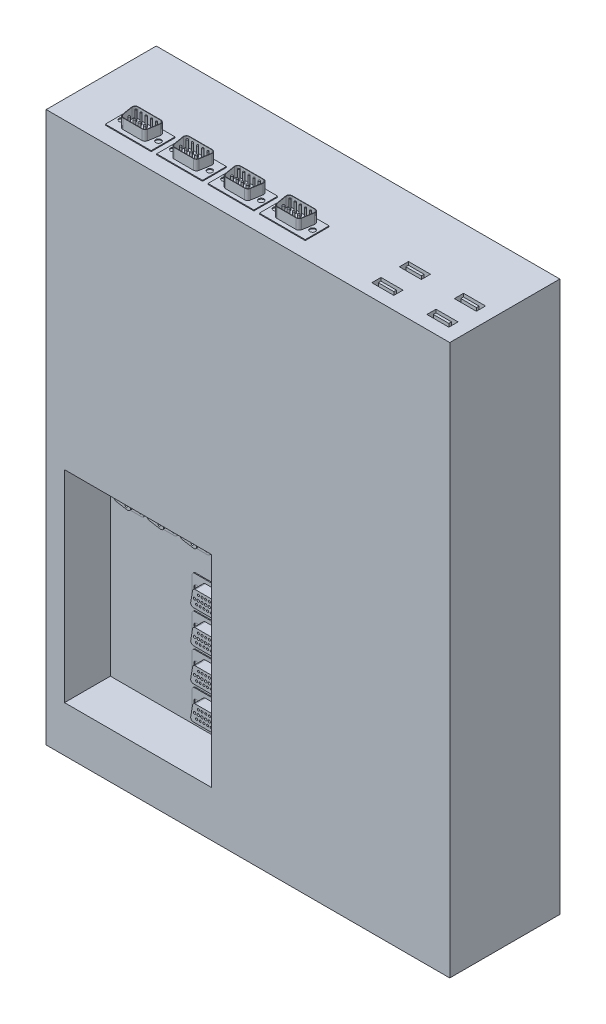
from build123d import *

# Parameters (mm, degrees)
SKETCH_1_W                     = 220
SKETCH_1_H                     = 300
EXTRUDE_1_DEPTH                = 60
SKETCH_2_W                     = 80
SKETCH_2_H                     = 110
CUT_EXTRUDE_1_DEPTH            = 25
SKETCH_3_R                     = 0.566514022
SKETCH_3_R_2                   = 0.666935082
SKETCH_3_R_3                   = 0.554127784
EXTRUDE_2_DEPTH                = 6
SKETCH_4_W                     = 32
SKETCH_4_H                     = 13
SKETCH_4_R                     = 1.5
EXTRUDE_3_DEPTH                = 0.5
FILLET_2_R                     = 1.5
PATTERN_LINEAR_1_COUNT         = 4
PATTERN_LINEAR_1_PITCH         = 18
FILLET_2_OF_PATTERN_LINEAR_1_R = 1.5
SKETCH_5_R                     = 0.592134008
SKETCH_5_R_2                   = 0.635459683
EXTRUDE_4_DEPTH                = 6
SKETCH_6_W                     = 13
SKETCH_6_H                     = 25
SKETCH_6_R                     = 1.5
EXTRUDE_5_DEPTH                = 0.5
FILLET_3_R                     = 1.5
PATTERN_LINEAR_2_COUNT         = 4
PATTERN_LINEAR_2_PITCH         = 18
FILLET_3_OF_PATTERN_LINEAR_2_R = 1.5
SKETCH_7_W                     = 25
SKETCH_7_H                     = 13
SKETCH_7_R                     = 1.5
EXTRUDE_6_DEPTH                = 0.5
SKETCH_8_R                     = 0.433526979
SKETCH_8_R_2                   = 0.542135856
EXTRUDE_7_DEPTH                = 5.5
PATTERN_LINEAR_3_COUNT         = 4
PATTERN_LINEAR_3_PITCH         = 28
SKETCH_9_W                     = 12
SKETCH_9_H                     = 5
SKETCH_9_W_2                   = 8.500436647
SKETCH_9_H_2                   = 1.430757523
CUT_EXTRUDE_2_DEPTH            = 15
PATTERN_LINEAR_4_COUNT         = 2
PATTERN_LINEAR_4_PITCH         = 15
PATTERN_LINEAR_4_COUNT_DIR2    = 2
PATTERN_LINEAR_4_PITCH_DIR2    = 30


with BuildPart() as part:
    # 草图1 → 凸台-拉伸1 (new body)
    with BuildSketch(Plane.XY):
        Rectangle(SKETCH_1_W, SKETCH_1_H)
    extrude(amount=EXTRUDE_1_DEPTH)

    # 草图2 → 切除-拉伸1 (cut)
    with BuildSketch(Plane.XY.offset(60)):
        with Locations((-60, -70)):
            Rectangle(SKETCH_2_W, SKETCH_2_H)
    extrude(amount=-CUT_EXTRUDE_1_DEPTH, mode=Mode.SUBTRACT)

    # 草图3 → 凸台-拉伸2 (add)
    with BuildSketch(Plane.XY.offset(35)):
        Polygon((-49, -55), (-29, -55), (-27.5, -64), (-50.5, -64), align=None)
        with Locations((-46.018214499, -56.859792147)):
            Circle(SKETCH_3_R, mode=Mode.SUBTRACT)
        with Locations((-44.018214499, -56.859792147)):
            Circle(SKETCH_3_R, mode=Mode.SUBTRACT)
        with Locations((-42.018214499, -56.859792147)):
            Circle(SKETCH_3_R, mode=Mode.SUBTRACT)
        with Locations((-40.018214499, -56.859792147)):
            Circle(SKETCH_3_R, mode=Mode.SUBTRACT)
        with Locations((-38.018214499, -56.859792147)):
            Circle(SKETCH_3_R, mode=Mode.SUBTRACT)
        with Locations((-36.018214499, -56.859792147)):
            Circle(SKETCH_3_R, mode=Mode.SUBTRACT)
        with Locations((-34.018214499, -56.859792147)):
            Circle(SKETCH_3_R, mode=Mode.SUBTRACT)
        with Locations((-32.018214499, -56.859792147)):
            Circle(SKETCH_3_R, mode=Mode.SUBTRACT)
        with Locations((-48.099511499, -59.46483549)):
            Circle(SKETCH_3_R_2, mode=Mode.SUBTRACT)
        with Locations((-46.099511499, -59.46483549)):
            Circle(SKETCH_3_R_2, mode=Mode.SUBTRACT)
        with Locations((-44.099511499, -59.46483549)):
            Circle(SKETCH_3_R_2, mode=Mode.SUBTRACT)
        with Locations((-42.099511499, -59.46483549)):
            Circle(SKETCH_3_R_2, mode=Mode.SUBTRACT)
        with Locations((-40.099511499, -59.46483549)):
            Circle(SKETCH_3_R_2, mode=Mode.SUBTRACT)
        with Locations((-38.099511499, -59.46483549)):
            Circle(SKETCH_3_R_2, mode=Mode.SUBTRACT)
        with Locations((-36.099511499, -59.46483549)):
            Circle(SKETCH_3_R_2, mode=Mode.SUBTRACT)
        with Locations((-34.099511499, -59.46483549)):
            Circle(SKETCH_3_R_2, mode=Mode.SUBTRACT)
        with Locations((-32.099511499, -59.46483549)):
            Circle(SKETCH_3_R_2, mode=Mode.SUBTRACT)
        with Locations((-47.025176069, -61.801365109)):
            Circle(SKETCH_3_R_3, mode=Mode.SUBTRACT)
        with Locations((-45.025176069, -61.801365109)):
            Circle(SKETCH_3_R_3, mode=Mode.SUBTRACT)
        with Locations((-43.025176069, -61.801365109)):
            Circle(SKETCH_3_R_3, mode=Mode.SUBTRACT)
        with Locations((-41.025176069, -61.801365109)):
            Circle(SKETCH_3_R_3, mode=Mode.SUBTRACT)
        with Locations((-39.025176069, -61.801365109)):
            Circle(SKETCH_3_R_3, mode=Mode.SUBTRACT)
        with Locations((-37.025176069, -61.801365109)):
            Circle(SKETCH_3_R_3, mode=Mode.SUBTRACT)
        with Locations((-35.025176069, -61.801365109)):
            Circle(SKETCH_3_R_3, mode=Mode.SUBTRACT)
        with Locations((-33.025176069, -61.801365109)):
            Circle(SKETCH_3_R_3, mode=Mode.SUBTRACT)
        with Locations((-31.025176069, -61.801365109)):
            Circle(SKETCH_3_R_3, mode=Mode.SUBTRACT)
    extrude_2 = extrude(amount=EXTRUDE_2_DEPTH)

    # 草图4 → 凸台-拉伸3 (add)
    with BuildSketch(Plane.XY.offset(35)):
        with Locations((-39, -59.5)):
            Rectangle(SKETCH_4_W, SKETCH_4_H)
        with Locations((-52.5, -59.5)):
            Circle(SKETCH_4_R, mode=Mode.SUBTRACT)
        with Locations((-25.5, -59.5)):
            Circle(SKETCH_4_R, mode=Mode.SUBTRACT)
    extrude_3 = extrude(amount=EXTRUDE_3_DEPTH)

    # 圆角2
    fillet_2_edges = [part.edges().sort_by_distance(p)[0] for p in [
        (-27.5, -64, 38.25),
        (-50.5, -64, 38.25),
        (-29, -55, 38.25),
        (-49, -55, 38.25),
        (-23, -53, 35.25),
        (-23, -66, 35.25),
        (-55, -66, 35.25),
        (-55, -53, 35.25),
    ]]
    fillet(fillet_2_edges, radius=FILLET_2_R)

    # 阵列(线性)1: 凸台-拉伸2, 凸台-拉伸3 ×4
    with Locations(*[(0, -i * PATTERN_LINEAR_1_PITCH, 0) for i in range(1, PATTERN_LINEAR_1_COUNT)]):
        add(extrude_2)
        add(extrude_3)

    # 圆角2 of 阵列(线性)1
    fillet_2_of_pattern_linear_1_edges = [part.edges().sort_by_distance(p)[0] for p in [
        (-27.5, -82, 38.25),
        (-50.5, -82, 38.25),
        (-29, -73, 38.25),
        (-49, -73, 38.25),
        (-23, -71, 35.25),
        (-23, -84, 35.25),
        (-55, -84, 35.25),
        (-55, -71, 35.25),
        (-27.5, -100, 38.25),
        (-50.5, -100, 38.25),
        (-29, -91, 38.25),
        (-49, -91, 38.25),
        (-23, -89, 35.25),
        (-23, -102, 35.25),
        (-55, -102, 35.25),
        (-55, -89, 35.25),
        (-27.5, -118, 38.25),
        (-50.5, -118, 38.25),
        (-29, -109, 38.25),
        (-49, -109, 38.25),
        (-23, -107, 35.25),
        (-23, -120, 35.25),
        (-55, -120, 35.25),
        (-55, -107, 35.25),
    ]]
    fillet(fillet_2_of_pattern_linear_1_edges, radius=FILLET_2_OF_PATTERN_LINEAR_1_R)

    # 草图5 → 凸台-拉伸4 (add)
    with BuildSketch(Plane.XY.offset(35)):
        Polygon((-83, -20.235360978), (-92, -21.735360978), (-92, -34.735360978), (-83, -36.235360978), align=None)
        with Locations((-89.4, -32.529164832)):
            Circle(SKETCH_5_R, mode=Mode.SUBTRACT)
        with Locations((-89.4, -29.729164832)):
            Circle(SKETCH_5_R, mode=Mode.SUBTRACT)
        with Locations((-89.4, -26.929164832)):
            Circle(SKETCH_5_R, mode=Mode.SUBTRACT)
        with Locations((-89.4, -24.129164832)):
            Circle(SKETCH_5_R, mode=Mode.SUBTRACT)
        with Locations((-85.380634092, -34.258761088)):
            Circle(SKETCH_5_R_2, mode=Mode.SUBTRACT)
        with Locations((-85.380634092, -31.458761088)):
            Circle(SKETCH_5_R_2, mode=Mode.SUBTRACT)
        with Locations((-85.380634092, -28.658761088)):
            Circle(SKETCH_5_R_2, mode=Mode.SUBTRACT)
        with Locations((-85.380634092, -25.858761088)):
            Circle(SKETCH_5_R_2, mode=Mode.SUBTRACT)
        with Locations((-85.380634092, -23.058761088)):
            Circle(SKETCH_5_R_2, mode=Mode.SUBTRACT)
    extrude_4 = extrude(amount=EXTRUDE_4_DEPTH)

    # 草图6 → 凸台-拉伸5 (add)
    with BuildSketch(Plane.XY.offset(35)):
        with Locations((-87.5, -28.235360978)):
            Rectangle(SKETCH_6_W, SKETCH_6_H)
        with Locations((-83.362394507, -18.235360978)):
            Circle(SKETCH_6_R, mode=Mode.SUBTRACT)
        with Locations((-83.362394507, -38.235360978)):
            Circle(SKETCH_6_R, mode=Mode.SUBTRACT)
    extrude_5 = extrude(amount=EXTRUDE_5_DEPTH)

    # 圆角3
    fillet_3_edges = [part.edges().sort_by_distance(p)[0] for p in [
        (-94, -15.735360978, 35.25),
        (-94, -40.735360978, 35.25),
        (-81, -40.735360978, 35.25),
        (-81, -15.735360978, 35.25),
        (-83, -20.235360978, 38.25),
        (-83, -36.235360978, 38.25),
        (-92, -34.735360978, 38.25),
        (-92, -21.735360978, 38.25),
    ]]
    fillet(fillet_3_edges, radius=FILLET_3_R)

    # 阵列(线性)2: 凸台-拉伸4, 凸台-拉伸5 ×4
    with Locations(*[(i * PATTERN_LINEAR_2_PITCH, 0, 0) for i in range(1, PATTERN_LINEAR_2_COUNT)]):
        add(extrude_4)
        add(extrude_5)

    # 圆角3 of 阵列(线性)2
    fillet_3_of_pattern_linear_2_edges = [part.edges().sort_by_distance(p)[0] for p in [
        (-76, -15.735360978, 35.25),
        (-76, -40.735360978, 35.25),
        (-63, -40.735360978, 35.25),
        (-63, -15.735360978, 35.25),
        (-65, -20.235360978, 38.25),
        (-65, -36.235360978, 38.25),
        (-74, -34.735360978, 38.25),
        (-74, -21.735360978, 38.25),
        (-58, -15.735360978, 35.25),
        (-58, -40.735360978, 35.25),
        (-45, -40.735360978, 35.25),
        (-45, -15.735360978, 35.25),
        (-47, -20.235360978, 38.25),
        (-47, -36.235360978, 38.25),
        (-56, -34.735360978, 38.25),
        (-56, -21.735360978, 38.25),
        (-40, -15.735360978, 35.25),
        (-40, -40.735360978, 35.25),
        (-27, -40.735360978, 35.25),
        (-27, -15.735360978, 35.25),
        (-29, -20.235360978, 38.25),
        (-29, -36.235360978, 38.25),
        (-38, -34.735360978, 38.25),
        (-38, -21.735360978, 38.25),
    ]]
    fillet(fillet_3_of_pattern_linear_2_edges, radius=FILLET_3_OF_PATTERN_LINEAR_2_R)

    # 草图7 → 凸台-拉伸6 (add)
    with BuildSketch(Plane(origin=(0, 150, 0), x_dir=(1, 0, 0), z_dir=(0, 1, 0))):
        with Locations((10, -44.77594123)):
            Rectangle(SKETCH_7_W, SKETCH_7_H)
        with Locations((0, -44.77594123)):
            Circle(SKETCH_7_R, mode=Mode.SUBTRACT)
        with Locations((20, -44.77594123)):
            Circle(SKETCH_7_R, mode=Mode.SUBTRACT)
    extrude_6 = extrude(amount=EXTRUDE_6_DEPTH)

    # 草图8 → 凸台-拉伸7 (add)
    # profile 1 of 10: a face of its own
    with BuildSketch(Plane(origin=(0, 150.5, 0), x_dir=(1, 0, 0), z_dir=(0, 1, 0))):
        with BuildLine():
            Line((16.229309367, -39.610423989), (3.770690633, -39.610423989))
            ThreePointArc((3.770690633, -39.610423989), (2.473556662, -40.211586666), (2.093820962, -41.589902268))
            Line((2.093820962, -41.589902268), (3.093820962, -47.589902268))
            ThreePointArc((3.093820962, -47.589902268), (3.671853309, -48.607557959), (4.770690633, -49.010423989))
            Line((4.770690633, -49.010423989), (15.229309367, -49.010423989))
            ThreePointArc((15.229309367, -49.010423989), (16.328146691, -48.607557959), (16.906179038, -47.589902268))
            Line((16.906179038, -47.589902268), (17.906179038, -41.589902268))
            ThreePointArc((17.906179038, -41.589902268), (17.526443338, -40.211586666), (16.229309367, -39.610423989))
        make_face()
        with BuildLine():
            Line((15.229309367, -48.810423989), (4.770690633, -48.810423989))
            ThreePointArc((4.770690633, -48.810423989), (3.801128288, -48.454953963), (3.291099747, -47.55702247))
            Line((3.291099747, -47.55702247), (2.291099747, -41.55702247))
            ThreePointArc((2.291099747, -41.55702247), (2.626160659, -40.340861645), (3.770690633, -39.810423989))
            Line((3.770690633, -39.810423989), (16.229309367, -39.810423989))
            ThreePointArc((16.229309367, -39.810423989), (17.373839341, -40.340861645), (17.708900253, -41.55702247))
            Line((17.708900253, -41.55702247), (16.708900253, -47.55702247))
            ThreePointArc((16.708900253, -47.55702247), (16.198871712, -48.454953963), (15.229309367, -48.810423989))
        make_face(mode=Mode.SUBTRACT)
    # profile 2 of 10: a face of its own
    with BuildSketch(Plane(origin=(0, 150.5, 0), x_dir=(1, 0, 0), z_dir=(0, 1, 0))):
        with Locations((4.5, -41.55702247)):
            Circle(SKETCH_8_R)
    # profile 3 of 10: a face of its own
    with BuildSketch(Plane(origin=(0, 150.5, 0), x_dir=(1, 0, 0), z_dir=(0, 1, 0))):
        with Locations((7.3, -41.55702247)):
            Circle(SKETCH_8_R)
    # profile 4 of 10: a face of its own
    with BuildSketch(Plane(origin=(0, 150.5, 0), x_dir=(1, 0, 0), z_dir=(0, 1, 0))):
        with Locations((10.1, -41.55702247)):
            Circle(SKETCH_8_R)
    # profile 5 of 10: a face of its own
    with BuildSketch(Plane(origin=(0, 150.5, 0), x_dir=(1, 0, 0), z_dir=(0, 1, 0))):
        with Locations((12.9, -41.55702247)):
            Circle(SKETCH_8_R)
    # profile 6 of 10: a face of its own
    with BuildSketch(Plane(origin=(0, 150.5, 0), x_dir=(1, 0, 0), z_dir=(0, 1, 0))):
        with Locations((15.7, -41.55702247)):
            Circle(SKETCH_8_R)
    # profile 7 of 10: a face of its own
    with BuildSketch(Plane(origin=(0, 150.5, 0), x_dir=(1, 0, 0), z_dir=(0, 1, 0))):
        with Locations((5.9, -46.569633988)):
            Circle(SKETCH_8_R_2)
    # profile 8 of 10: a face of its own
    with BuildSketch(Plane(origin=(0, 150.5, 0), x_dir=(1, 0, 0), z_dir=(0, 1, 0))):
        with Locations((8.7, -46.569633988)):
            Circle(SKETCH_8_R_2)
    # profile 9 of 10: a face of its own
    with BuildSketch(Plane(origin=(0, 150.5, 0), x_dir=(1, 0, 0), z_dir=(0, 1, 0))):
        with Locations((11.5, -46.569633988)):
            Circle(SKETCH_8_R_2)
    # profile 10 of 10: a face of its own
    with BuildSketch(Plane(origin=(0, 150.5, 0), x_dir=(1, 0, 0), z_dir=(0, 1, 0))):
        with Locations((14.3, -46.569633988)):
            Circle(SKETCH_8_R_2)
    extrude_7 = extrude(amount=EXTRUDE_7_DEPTH)

    # 阵列(线性)3: 凸台-拉伸6, 凸台-拉伸7 ×4
    with Locations(*[(-i * PATTERN_LINEAR_3_PITCH, 0, 0) for i in range(1, PATTERN_LINEAR_3_COUNT)]):
        add(extrude_6)
        add(extrude_7)

    # 草图9 → 切除-拉伸2 (cut)
    with BuildSketch(Plane(origin=(0, 150, 0), x_dir=(1, 0, 0), z_dir=(0, 1, 0))):
        with Locations((96.501288718, -50.489416374)):
            Rectangle(SKETCH_9_W, SKETCH_9_H)
        with Locations((96.501288719, -50.489416374)):
            Rectangle(SKETCH_9_W_2, SKETCH_9_H_2, mode=Mode.SUBTRACT)
    cut_extrude_2 = extrude(amount=-CUT_EXTRUDE_2_DEPTH, mode=Mode.SUBTRACT)

    # 阵列(线性)4: Cut-Extrude 2 2 × 2
    with Locations(*[(-j * PATTERN_LINEAR_4_PITCH_DIR2, 0, -i * PATTERN_LINEAR_4_PITCH) for i in range(PATTERN_LINEAR_4_COUNT) for j in range(PATTERN_LINEAR_4_COUNT_DIR2) if (i, j) != (0, 0)]):
        add(cut_extrude_2, mode=Mode.SUBTRACT)


solid = part.part
